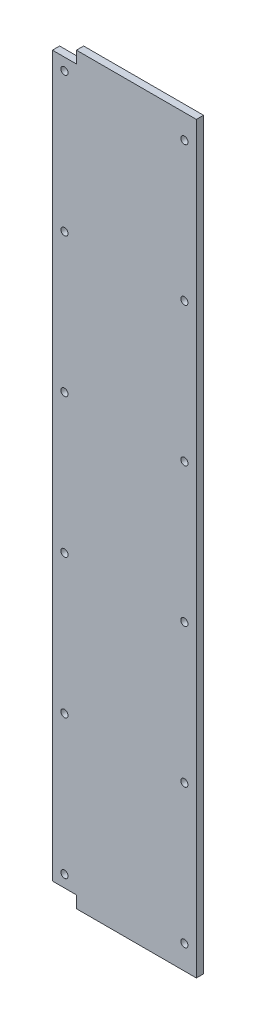
from build123d import *

# Parameters (mm, degrees)
ESQUISSE1_R        = 1.5
BOSS_EXTRU_1_DEPTH = 3


with BuildPart() as part:
    # Esquisse1 → Boss.-Extru.1 (new body)
    with BuildSketch(Plane.XY):
        Polygon((-20, -155), (30, -155), (30, 155), (-20, 155), (-20, 150), (-30, 150), (-30, -150), (-20, -150), align=None)
        with Locations((-25, -145)):
            Circle(ESQUISSE1_R, mode=Mode.SUBTRACT)
        with Locations((-25, -87)):
            Circle(ESQUISSE1_R, mode=Mode.SUBTRACT)
        with Locations((-25, -29)):
            Circle(ESQUISSE1_R, mode=Mode.SUBTRACT)
        with Locations((25, -145)):
            Circle(ESQUISSE1_R, mode=Mode.SUBTRACT)
        with Locations((25, -87)):
            Circle(ESQUISSE1_R, mode=Mode.SUBTRACT)
        with Locations((25, -29)):
            Circle(ESQUISSE1_R, mode=Mode.SUBTRACT)
        with Locations((-25, 29)):
            Circle(ESQUISSE1_R, mode=Mode.SUBTRACT)
        with Locations((-25, 87)):
            Circle(ESQUISSE1_R, mode=Mode.SUBTRACT)
        with Locations((-25, 145)):
            Circle(ESQUISSE1_R, mode=Mode.SUBTRACT)
        with Locations((25, 29)):
            Circle(ESQUISSE1_R, mode=Mode.SUBTRACT)
        with Locations((25, 87)):
            Circle(ESQUISSE1_R, mode=Mode.SUBTRACT)
        with Locations((25, 145)):
            Circle(ESQUISSE1_R, mode=Mode.SUBTRACT)
    extrude(amount=BOSS_EXTRU_1_DEPTH)


solid = part.part
